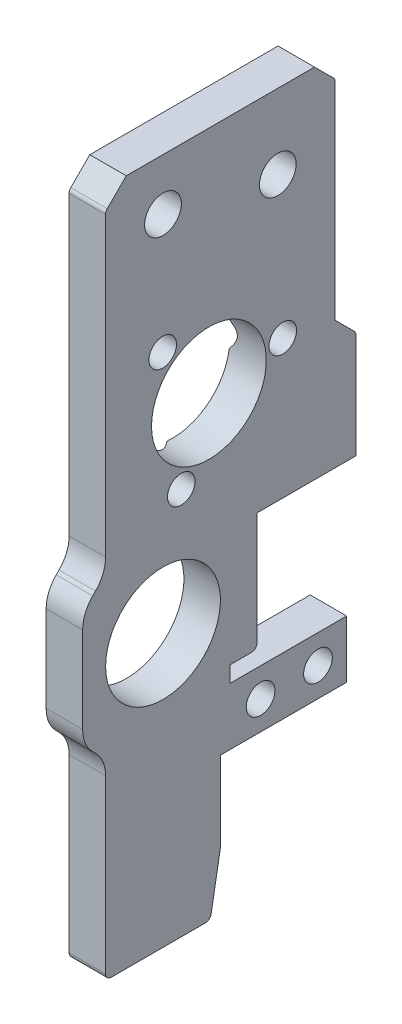
from build123d import *

# Parameters (mm, degrees)
SKETCH1_R                                       = 5
SKETCH1_R_2                                     = 1.6
SKETCH1_R_3                                     = 1.25
BOSS_EXTRUDE1_DEPTH                             = 3.18
CHAMFER1_SIZE                                   = 5
CHAMFER1_SIZE2                                  = 0.881634904
CSK_FOR_M2_FLAT_HEAD_MACHINE_SCREW1_D           = 2.4
CSK_FOR_M2_FLAT_HEAD_MACHINE_SCREW1_DEPTH       = 3.508967257
CSK_FOR_M2_FLAT_HEAD_MACHINE_SCREW1_CSINK_D     = 4.4
CSK_FOR_M2_FLAT_HEAD_MACHINE_SCREW1_CSINK_ANGLE = 90
CSK_FOR_M2_FLAT_HEAD_MACHINE_SCREW1_TIP         = 0.721032743
SKETCH3_R                                       = 5
CUT_EXTRUDE4_DEPTH                              = 64.738438167
FILLET2_R                                       = 3
CHAMFER2_SIZE                                   = 1.8
FILLET4_R                                       = 0.5


with BuildPart() as part:
    # Sketch1 → Boss-Extrude1 (new body)
    with BuildSketch(Plane(origin=(0, 0, 0), x_dir=(0, 0, -1), z_dir=(1, 0, 0))):
        Polygon((0, 0), (0, 16.7), (-2, 18.7), (-2, 28.7), (0, 30.7), (0, 59.81), (20, 59.81), (20, 39.81), (21.8, 39.81), (21.8, 28.68), (13.2, 28.68), (13.2, 18.4), (10.85, 18.4), (10.85, 17), (21, 17), (21, 12), (10, 12), (10, 0), align=None)
        with Locations(Location((5, 23.7, 0), (0, 0, 180))):
            Circle(SKETCH1_R, mode=Mode.SUBTRACT)
        with Locations(Location((5, 55.31, 0), (0, 0, 180))):
            Circle(SKETCH1_R_2, mode=Mode.SUBTRACT)
        with Locations(Location((15, 53.31, 0), (0, 0, 180))):
            Circle(SKETCH1_R_2, mode=Mode.SUBTRACT)
        with Locations(Location((18.5, 14.5, 0), (0, 0, 180))):
            Circle(SKETCH1_R_3, mode=Mode.SUBTRACT)
        with Locations(Location((13.5, 14.5, 0), (0, 0, 180))):
            Circle(SKETCH1_R_3, mode=Mode.SUBTRACT)
    extrude(amount=BOSS_EXTRUDE1_DEPTH)

    # Chamfer1
    chamfer1_edges = [part.edges().sort_by_distance(p)[0] for p in [
        (1.59, 0, -10),
    ]]
    chamfer1_side = [part.faces().sort_by_distance(p)[0] for p in [
        (1.59, 6, -10),
    ]]
    chamfer(chamfer1_edges, length=CHAMFER1_SIZE, length2=CHAMFER1_SIZE2, reference=chamfer1_side[0])

    # CSK for M2 Flat Head Machine Screw1
    with Locations(Plane.ZY):
        with Locations((-4.974936087, 44.914674329), (-15.432559713, 40.744769284), (-6.592504199, 33.773154083)):
            CounterSinkHole(CSK_FOR_M2_FLAT_HEAD_MACHINE_SCREW1_D / 2, CSK_FOR_M2_FLAT_HEAD_MACHINE_SCREW1_CSINK_D / 2, depth=CSK_FOR_M2_FLAT_HEAD_MACHINE_SCREW1_DEPTH, counter_sink_angle=CSK_FOR_M2_FLAT_HEAD_MACHINE_SCREW1_CSINK_ANGLE)
            with Locations((0, 0, -(CSK_FOR_M2_FLAT_HEAD_MACHINE_SCREW1_DEPTH + CSK_FOR_M2_FLAT_HEAD_MACHINE_SCREW1_TIP / 2))):  # 118° drill point
                Cone(0, CSK_FOR_M2_FLAT_HEAD_MACHINE_SCREW1_D / 2, CSK_FOR_M2_FLAT_HEAD_MACHINE_SCREW1_TIP, mode=Mode.SUBTRACT)

    # Sketch3 → Cut-Extrude4 (cut, through all)
    with BuildSketch(Plane.ZY):
        with Locations((-9, 39.810865899)):
            Circle(SKETCH3_R)
    extrude(amount=-CUT_EXTRUDE4_DEPTH, mode=Mode.SUBTRACT)

    # Fillet2
    fillet2_edges = [part.edges().sort_by_distance(p)[0] for p in [
        (1.59, 16.7, 0),
        (1.59, 18.7, 2),
        (1.59, 28.7, 2),
        (1.59, 30.7, 0),
    ]]
    fillet(fillet2_edges, radius=FILLET2_R)

    # Chamfer2
    chamfer2_edges = [part.edges().sort_by_distance(p)[0] for p in [
        (1.59, 59.81, -20),
        (1.59, 59.81, 0),
        (1.59, 39.81, -21.8),
    ]]
    chamfer(chamfer2_edges, length=CHAMFER2_SIZE - 0.0001)  # a hair under: the kernel refuses the full size

    # Fillet4
    fillet4_edges = [part.edges().sort_by_distance(p)[0] for p in [
        (1.59, 38.0101, -21.8),
        (1.59, 58.0101, -20),
        (1.59, 58.0101, 0),
        (1.59, 0, 0),
        (1.59, 18.4, -13.2),
        (1.59, 0, -9.118365096),
    ]]
    fillet(fillet4_edges, radius=FILLET4_R)


solid = part.part
